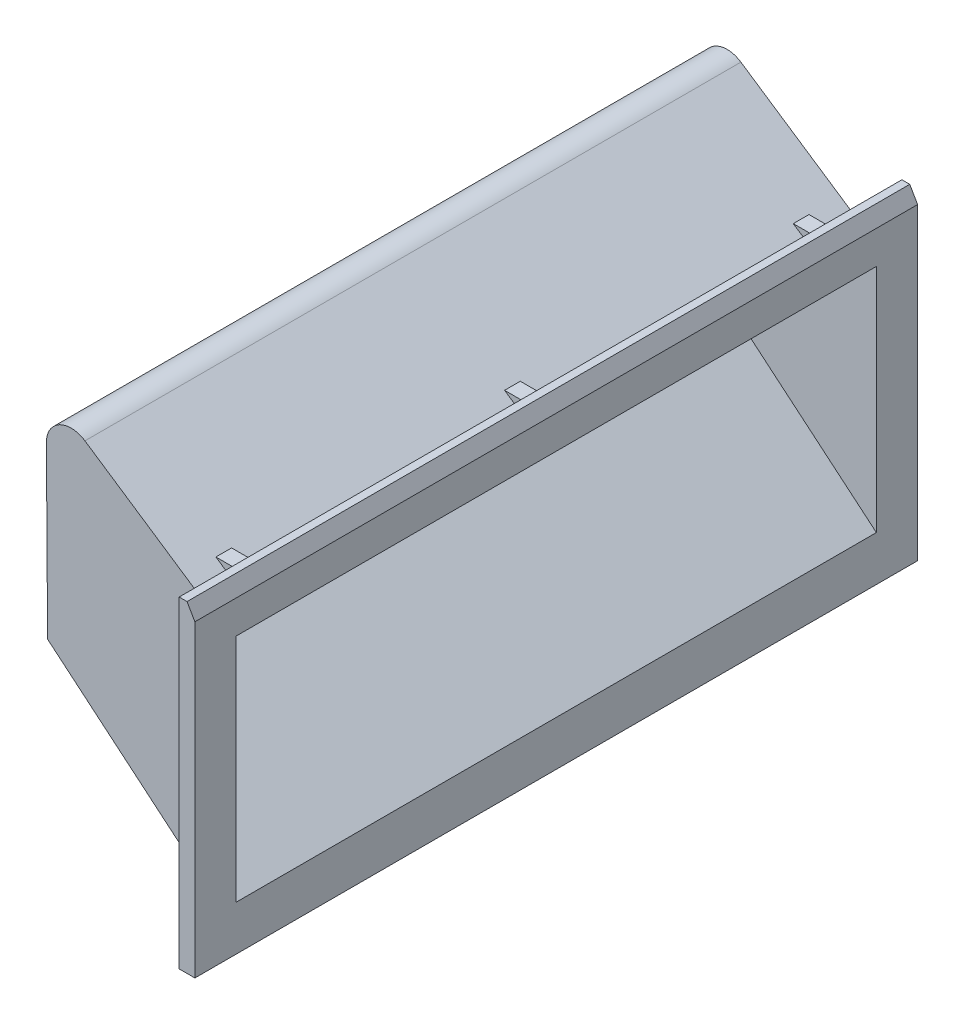
from build123d import *

# Parameters (mm, degrees)
EXTRUDE_1_DEPTH          = 46
EXTRUDE_1_DEPTH_BACK     = 46
EXTRUDE_2_DEPTH          = 41.75
EXTRUDE_2_DEPTH_BACK     = 41.75
CUT_EXTRUDE_1_DEPTH      = 40.75
CUT_EXTRUDE_1_DEPTH_BACK = 40.75
EXTRUDE_3_DEPTH          = 1
EXTRUDE_3_DEPTH_BACK     = 1
EXTRUDE_4_DEPTH          = 1
EXTRUDE_4_DEPTH_BACK     = 1
EXTRUDE_5_DEPTH          = 1
EXTRUDE_5_DEPTH_BACK     = 1
EXTRUDE_6_DEPTH          = 2
EXTRUDE_6_DEPTH_BACK     = 2
EXTRUDE_7_DEPTH          = 2
EXTRUDE_7_DEPTH_BACK     = 2


with BuildPart() as part:
    # 草图1 → 凸台-拉伸1 (new, two sides: drawn at the far end of the back side and taken through both)
    with BuildSketch(Plane.XY.offset(-EXTRUDE_1_DEPTH_BACK)):
        Polygon((-2, 41), (-2, 0), (0, 0), (0, 39.267949192), (-1, 41), align=None)
    extrude(amount=EXTRUDE_1_DEPTH + EXTRUDE_1_DEPTH_BACK)

    # 草图2 → 凸台-拉伸2 (add, two sides: drawn at the far end of the back side and taken through both)
    with BuildSketch(Plane.XY.offset(-EXTRUDE_2_DEPTH_BACK)):
        with BuildLine():
            Line((-23.15444772, 45.322915161), (-23, 23.723915946))
            Line((-23, 23.723915946), (-2, 6.102823691))
            Line((-2, 6.102823691), (-2, 37.107539179))
            Line((-2, 37.107539179), (-18.24692063, 47.968020382))
            ThreePointArc((-18.24692063, 47.968020382), (-21.496697605, 48.122330559), (-23.15444772, 45.322915161))
        make_face()
    extrude(amount=EXTRUDE_2_DEPTH + EXTRUDE_2_DEPTH_BACK)

    # 草图3 → 切除-拉伸1 (cut, two sides: drawn at the far end of the back side and taken through both)
    with BuildSketch(Plane.XY.offset(-CUT_EXTRUDE_1_DEPTH_BACK)):
        with BuildLine():
            Line((-22, 24.190223604), (0, 5.730031718))
            Line((0, 5.730031718), (0, 35.071545943))
            Line((0, 35.071545943), (-18.919301008, 47.184362345))
            ThreePointArc((-18.919301008, 47.184362345), (-20.957600798, 47.254585951), (-21.9976903, 45.500216772))
            Line((-21.9976903, 45.500216772), (-22, 24.190223604))
        make_face()
    extrude(amount=CUT_EXTRUDE_1_DEPTH + CUT_EXTRUDE_1_DEPTH_BACK, mode=Mode.SUBTRACT)

    # 草图4 → 凸台-拉伸3 (add, two sides: drawn at the far end of the back side and taken through both)
    with BuildSketch(Plane.XY.offset(-EXTRUDE_3_DEPTH_BACK)):
        Polygon((-8.210146219, 39.5), (-3.5, 37.303622747), (-3.5, 39.5), align=None)
    extrude(amount=EXTRUDE_3_DEPTH + EXTRUDE_3_DEPTH_BACK)

    # 草图6 → 凸台-拉伸4 (add, two sides: drawn at the far end of the back side and taken through both)
    with BuildSketch(Plane.XY.offset(-36.75).offset(-EXTRUDE_4_DEPTH_BACK)):
        Polygon((-8.210146219, 39.5), (-3.5, 37.303622747), (-3.5, 39.5), align=None)
    extrude(amount=EXTRUDE_4_DEPTH + EXTRUDE_4_DEPTH_BACK)

    # 草图5 → 凸台-拉伸5 (add, two sides: drawn at the far end of the back side and taken through both)
    with BuildSketch(Plane.XY.offset(36.75).offset(-EXTRUDE_5_DEPTH_BACK)):
        Polygon((-8.210146219, 39.5), (-3.5, 37.303622747), (-3.5, 39.5), align=None)
    extrude(amount=EXTRUDE_5_DEPTH + EXTRUDE_5_DEPTH_BACK)

    # 草图7 → 凸台-拉伸6 (add, two sides: drawn at the far end of the back side and taken through both)
    with BuildSketch(Plane.XY.offset(-36.75).offset(-EXTRUDE_6_DEPTH_BACK)):
        Polygon((-13.201666314, 16.207545053), (-3.5, 4.645549369), (-3.5, 8.066880427), align=None)
    extrude(amount=EXTRUDE_6_DEPTH + EXTRUDE_6_DEPTH_BACK)

    # 草图8 → 凸台-拉伸7 (add, two sides: drawn at the far end of the back side and taken through both)
    with BuildSketch(Plane.XY.offset(36.75).offset(-EXTRUDE_7_DEPTH_BACK)):
        Polygon((-13.201666314, 16.207545053), (-3.5, 4.645549369), (-3.5, 8.066880427), align=None)
    extrude(amount=EXTRUDE_7_DEPTH + EXTRUDE_7_DEPTH_BACK)


solid = part.part
